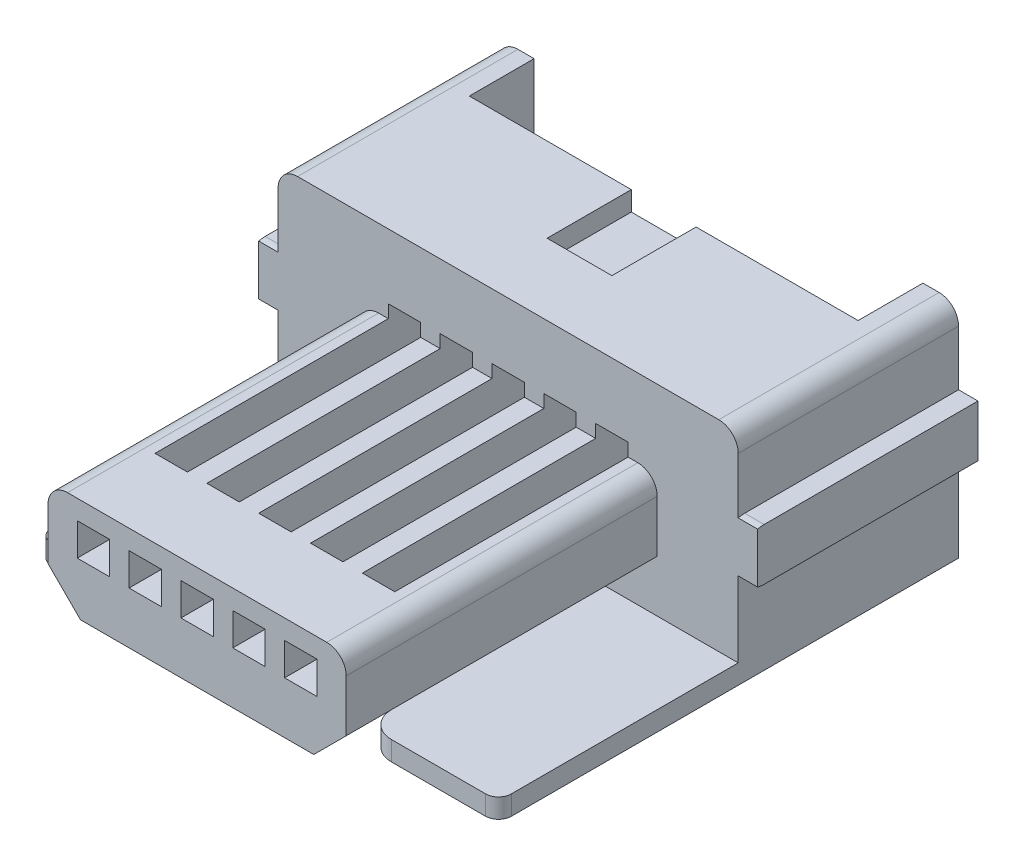
from build123d import *

# Parameters (mm, degrees)
BOSS_EXTRUDE1_DEPTH = 8.2
BOSS_EXTRUDE2_DEPTH = 3.85
SKETCH3_OUTSIDE_W   = 12.05
SKETCH3_OUTSIDE_H   = 7.75
CUT_EXTRUDE1_DEPTH  = 4.8
SKETCH4_W           = 1
SKETCH4_H           = 0.3
CUT_EXTRUDE3_DEPTH  = 2.3
CUT_EXTRUDE6_DEPTH  = 10.675872054
SKETCH6_W           = 0.5
SKETCH6_H           = 0.5
CUT_EXTRUDE7_DEPTH  = 2
SKETCH7_W           = 0.5
SKETCH7_H           = 0.8
CUT_EXTRUDE8_DEPTH  = 7
SKETCH8_W           = 6
SKETCH8_H           = 1
CUT_EXTRUDE9_DEPTH  = 2
SKETCH9_W           = 6
SKETCH9_H           = 0.5
CUT_EXTRUDE10_DEPTH = 1
SKETCH10_R          = 0.4
BOSS_EXTRUDE3_DEPTH = 1.1
CHAMFER1_SIZE       = 0.2
SKETCH11_W          = 7.1
SKETCH11_H          = 0.3
BOSS_EXTRUDE4_DEPTH = 3.7
FILLET1_R           = 0.2
SKETCH12_W          = 3
SKETCH12_H          = 2
CUT_EXTRUDE11_DEPTH = 0.5
FILLET2_R           = 0.2
FILLET3_R           = 0.4


with BuildPart() as part:
    # Sketch1 → Boss-Extrude1 (new body)
    with BuildSketch(Plane.XY):
        with BuildLine():
            Line((-3.25, 3.4), (3.25, 3.4))
            ThreePointArc((3.25, 3.4), (3.462132034, 3.312132034), (3.55, 3.1))
            Line((3.55, 3.1), (3.55, 0))
            Line((3.55, 0), (-3.55, 0))
            Line((-3.55, 0), (-3.55, 3.1))
            ThreePointArc((-3.55, 3.1), (-3.462132034, 3.312132034), (-3.25, 3.4))
        make_face()
    extrude(amount=BOSS_EXTRUDE1_DEPTH)

    # Sketch2 → Boss-Extrude2 (add, symmetric)
    with BuildSketch(Plane(origin=(0, 0, 0), x_dir=(0, 0, -1), z_dir=(1, 0, 0))):
        with BuildLine():
            Line((0, 2.25), (-3.3, 2.25))
            ThreePointArc((-3.3, 2.25), (-3.7, 1.85), (-3.3, 1.45))
            Line((-3.3, 1.45), (0, 1.45))
            Line((0, 1.45), (0, 2.25))
        make_face()
    extrude(amount=BOSS_EXTRUDE2_DEPTH, both=True)

    # Sketch3 outside → Cut-Extrude1 (cut)
    with BuildSketch(Plane.XY.offset(8.2)):
        with Locations((0, 1.7)):
            Rectangle(SKETCH3_OUTSIDE_W, SKETCH3_OUTSIDE_H)
        with BuildLine():
            Line((-2, 2.2), (2, 2.2))
            ThreePointArc((2, 2.2), (2.212132034, 2.112132034), (2.3, 1.9))
            Line((2.3, 1.9), (2.3, 1.1))
            Line((2.3, 1.1), (1.8, 0.6))
            Line((1.8, 0.6), (-1.8, 0.6))
            Line((-1.8, 0.6), (-2.3, 1.1))
            Line((-2.3, 1.1), (-2.3, 1.9))
            ThreePointArc((-2.3, 1.9), (-2.212132034, 2.112132034), (-2, 2.2))
        make_face(mode=Mode.SUBTRACT)
    extrude(amount=-CUT_EXTRUDE1_DEPTH, mode=Mode.SUBTRACT)

    # Sketch4 → Cut-Extrude3 (cut)
    with BuildSketch(Plane.XY):
        with Locations((0, 3.25)):
            Rectangle(SKETCH4_W, SKETCH4_H)
    extrude(amount=CUT_EXTRUDE3_DEPTH, mode=Mode.SUBTRACT)

    # Sketch5 → Cut-Extrude6 (cut, through all)
    with BuildSketch(Plane(origin=(0, 0, 0), x_dir=(1, 0, 0), z_dir=(0, 1, 0))):
        Polygon((-1.85, 0), (1.85, 0), (1.85, -1), (1.35, -1), (1.35, -0.7), (1.05, -0.7), (1.05, -1), (0.55, -1), (0.55, -0.7), (0.25, -0.7), (0.25, -1), (-0.25, -1), (-0.25, -0.7), (-0.55, -0.7), (-0.55, -1), (-1.05, -1), (-1.05, -0.7), (-1.35, -0.7), (-1.35, -1), (-1.85, -1), align=None)
    extrude(amount=CUT_EXTRUDE6_DEPTH, mode=Mode.SUBTRACT)

    # Sketch6 → Cut-Extrude7 (cut)
    with BuildSketch(Plane.XY.offset(8.2)):
        with Locations((1.6, 1.65)):
            Rectangle(SKETCH6_W, SKETCH6_H)
        with Locations((0.8, 1.65)):
            Rectangle(SKETCH6_W, SKETCH6_H)
        with Locations((0, 1.65)):
            Rectangle(SKETCH6_W, SKETCH6_H)
        with Locations((-0.8, 1.65)):
            Rectangle(SKETCH6_W, SKETCH6_H)
        with Locations((-1.6, 1.65)):
            Rectangle(SKETCH6_W, SKETCH6_H)
    extrude(amount=-CUT_EXTRUDE7_DEPTH, mode=Mode.SUBTRACT)

    # Sketch7 → Cut-Extrude8 (cut)
    with BuildSketch(Plane.XY):
        with Locations((1.6, 2)):
            Rectangle(SKETCH7_W, SKETCH7_H)
        with Locations((0.8, 2)):
            Rectangle(SKETCH7_W, SKETCH7_H)
        with Locations((0, 2)):
            Rectangle(SKETCH7_W, SKETCH7_H)
        with Locations((-0.8, 2)):
            Rectangle(SKETCH7_W, SKETCH7_H)
        with Locations((-1.6, 2)):
            Rectangle(SKETCH7_W, SKETCH7_H)
    extrude(amount=CUT_EXTRUDE8_DEPTH, mode=Mode.SUBTRACT)

    # Sketch8 → Cut-Extrude9 (cut)
    with BuildSketch(Plane(origin=(0, 3.4, 0), x_dir=(1, 0, 0), z_dir=(0, 1, 0))):
        with Locations((0, -0.5)):
            Rectangle(SKETCH8_W, SKETCH8_H)
    extrude(amount=-CUT_EXTRUDE9_DEPTH, mode=Mode.SUBTRACT)

    # Sketch9 → Cut-Extrude10 (cut)
    with BuildSketch(Plane.XY):
        with Locations((0, 0.25)):
            Rectangle(SKETCH9_W, SKETCH9_H)
    extrude(amount=CUT_EXTRUDE10_DEPTH, mode=Mode.SUBTRACT)

    # Sketch10 → Boss-Extrude3 (add)
    with BuildSketch(Plane.XZ):
        with Locations((2.2, 3.05)):
            Circle(SKETCH10_R)
        with Locations((-2.2, 3.05)):
            Circle(SKETCH10_R)
    extrude(amount=BOSS_EXTRUDE3_DEPTH)

    # Chamfer1
    chamfer1_edges = [part.edges().sort_by_distance(p)[0] for p in [
        (1.8, -1.1, 3.05),
        (-2.6, -1.1, 3.05),
    ]]
    chamfer(chamfer1_edges, length=CHAMFER1_SIZE)

    # Sketch11 → Boss-Extrude4 (add)
    with BuildSketch(Plane.XY.offset(3.4)):
        with Locations((0, 0.15)):
            Rectangle(SKETCH11_W, SKETCH11_H)
    extrude(amount=BOSS_EXTRUDE4_DEPTH)

    # Fillet1
    fillet1_edges = [part.edges().sort_by_distance(p)[0] for p in [
        (3.55, 0.15, 7.1),
        (-3.55, 0.15, 7.1),
    ]]
    fillet(fillet1_edges, radius=FILLET1_R)

    # Sketch12 → Cut-Extrude11 (cut)
    with BuildSketch(Plane.XZ):
        with Locations((0, 6.1)):
            Rectangle(SKETCH12_W, SKETCH12_H)
    extrude(amount=-CUT_EXTRUDE11_DEPTH, mode=Mode.SUBTRACT)

    # Fillet2
    fillet2_edges = [part.edges().sort_by_distance(p)[0] for p in [
        (-1.5, 0.15, 5.1),
        (1.5, 0.15, 5.1),
    ]]
    fillet(fillet2_edges, radius=FILLET2_R)

    # Fillet3
    fillet3_edges = [part.edges().sort_by_distance(p)[0] for p in [
        (-1.5, 0.15, 7.1),
        (1.5, 0.15, 7.1),
    ]]
    fillet(fillet3_edges, radius=FILLET3_R)


solid = part.part
